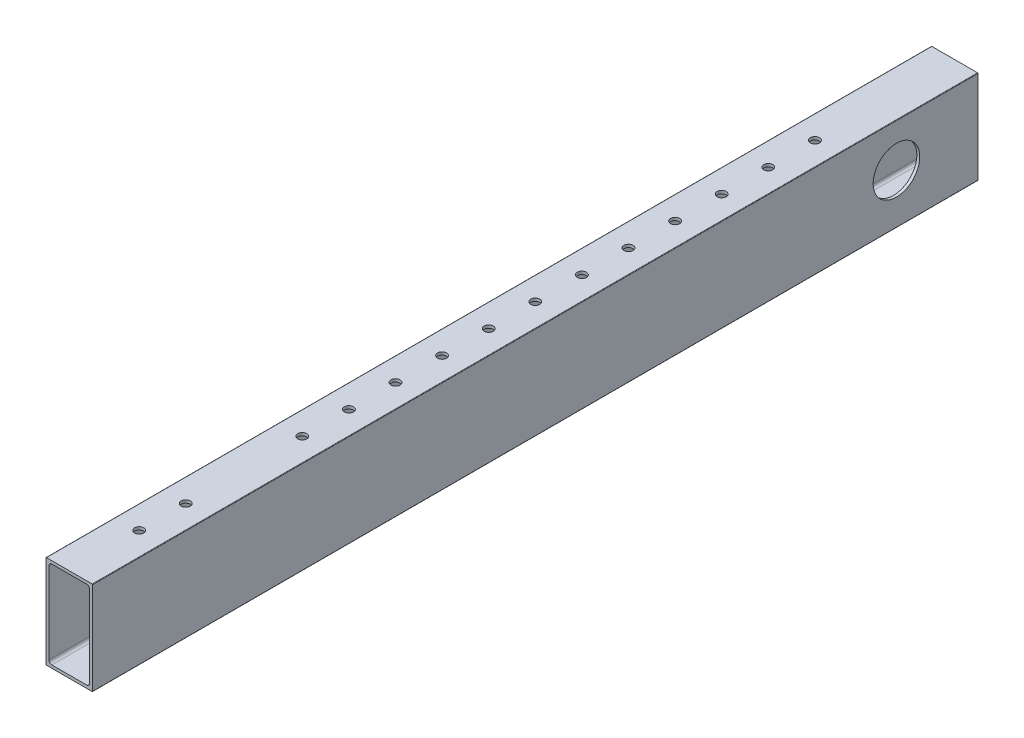
from build123d import *

# Parameters (mm, degrees)
BOSS_EXTRUDE1_DEPTH      = 25.4
BOSS_EXTRUDE1_DEPTH_BACK = 457.2
SKETCH2_R                = 12.7
CUT_EXTRUDE1_DEPTH       = 25.4
CUT_EXTRUDE2_DEPTH       = 461.188841673
CUT_EXTRUDE2_DEPTH_BACK  = 461.188841673
SKETCH3_R                = 2.4892


with BuildPart() as part:
    # Sketch1 → Boss-Extrude1 (new, two sides: drawn at the far end of the back side and taken through both)
    with BuildSketch(Plane(origin=(0, 0, 0), x_dir=(-1, 0, 0), z_dir=(0, 0, -1)).offset(-BOSS_EXTRUDE1_DEPTH_BACK)):
        with BuildLine():
            Line((-12.7, 25.146), (-12.7, -25.146))
            ThreePointArc((-12.7, -25.146), (-12.625605122, -25.325605122), (-12.446, -25.4))
            Line((-12.446, -25.4), (12.446, -25.4))
            ThreePointArc((12.446, -25.4), (12.625605122, -25.325605122), (12.7, -25.146))
            Line((12.7, -25.146), (12.7, 25.146))
            ThreePointArc((12.7, 25.146), (12.625605122, 25.325605122), (12.446, 25.4))
            Line((12.446, 25.4), (-12.446, 25.4))
            ThreePointArc((-12.446, 25.4), (-12.625605122, 25.325605122), (-12.7, 25.146))
        make_face()
        with BuildLine():
            Line((-11.1125, -22.225), (-11.1125, 22.225))
            ThreePointArc((-11.1125, 22.225), (-10.647532015, 23.347532015), (-9.525, 23.8125))
            Line((-9.525, 23.8125), (9.525, 23.8125))
            ThreePointArc((9.525, 23.8125), (10.647532015, 23.347532015), (11.1125, 22.225))
            Line((11.1125, 22.225), (11.1125, -22.225))
            ThreePointArc((11.1125, -22.225), (10.647532015, -23.347532015), (9.525, -23.8125))
            Line((9.525, -23.8125), (-9.525, -23.8125))
            ThreePointArc((-9.525, -23.8125), (-10.647532015, -23.347532015), (-11.1125, -22.225))
        make_face(mode=Mode.SUBTRACT)
    extrude(amount=BOSS_EXTRUDE1_DEPTH + BOSS_EXTRUDE1_DEPTH_BACK)

    # Sketch2 → Cut-Extrude1 (cut)
    with BuildSketch(Plane.ZY.offset(12.7)):
        with Locations((19.05, 1.778)):
            Circle(SKETCH2_R)
    extrude(amount=-CUT_EXTRUDE1_DEPTH, mode=Mode.SUBTRACT)

    # Sketch3 → Cut-Extrude2 (cut, two sides: drawn at the far end of the back side and taken through both)
    with BuildSketch(Plane.XZ.offset(25.4).offset(-CUT_EXTRUDE2_DEPTH_BACK)):
        with Locations((0, 50.8)):
            Circle(SKETCH3_R)
        with Locations((0, 76.2)):
            Circle(SKETCH3_R)
        with Locations((0, 101.6)):
            Circle(SKETCH3_R)
        with Locations((0, 127)):
            Circle(SKETCH3_R)
        with Locations((0, 152.4)):
            Circle(SKETCH3_R)
        with Locations((0, 177.8)):
            Circle(SKETCH3_R)
        with Locations((0, 203.2)):
            Circle(SKETCH3_R)
        with Locations((0, 228.6)):
            Circle(SKETCH3_R)
        with Locations((0, 254)):
            Circle(SKETCH3_R)
        with Locations((0, 279.4)):
            Circle(SKETCH3_R)
        with Locations((0, 304.8)):
            Circle(SKETCH3_R)
        with Locations((0, 393.7)):
            Circle(SKETCH3_R)
        with Locations((0, 419.1)):
            Circle(SKETCH3_R)
        with Locations((0, 330.2)):
            Circle(SKETCH3_R)
    extrude(amount=CUT_EXTRUDE2_DEPTH + CUT_EXTRUDE2_DEPTH_BACK, mode=Mode.SUBTRACT)


solid = part.part
